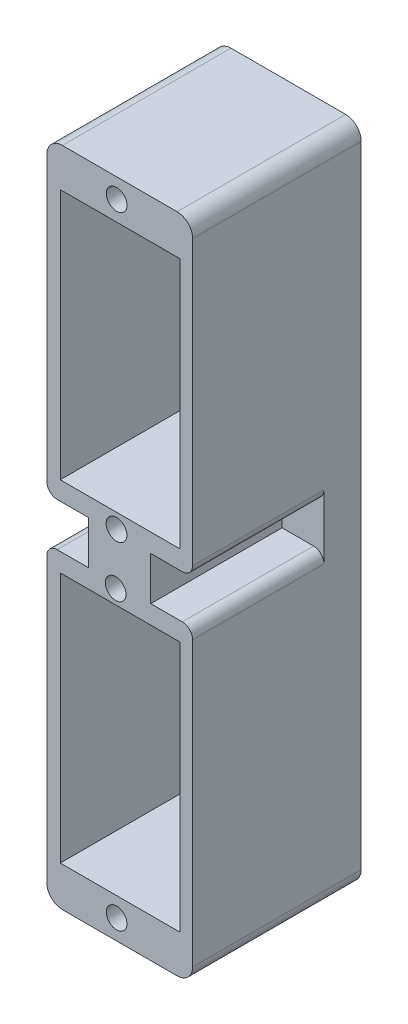
from build123d import *

# Parameters (mm, degrees)
SKETCH4_W           = 14.1
SKETCH4_H           = 64
BOSS_EXTRUDE1_DEPTH = 16.3
FILLET1_R           = 1.5
SKETCH5_W           = 11.6
SKETCH5_H           = 24.3
CUT_EXTRUDE1_DEPTH  = 16.3
SKETCH6_W           = 4.05
SKETCH6_H           = 4.2
CUT_EXTRUDE2_DEPTH  = 12.7
FILLET2_R           = 1
SKETCH7_R           = 1
CUT_EXTRUDE3_DEPTH  = 16.3


with BuildPart() as part:
    # Sketch4 → Boss-Extrude1 (new body)
    with BuildSketch(Plane.XY.offset(30)):
        with Locations((-182.786990356, 243.547210693)):
            Rectangle(SKETCH4_W, SKETCH4_H)
    extrude(amount=BOSS_EXTRUDE1_DEPTH)

    # Fillet1
    fillet1_edges = [part.edges().sort_by_distance(p)[0] for p in [
        (-189.836990356, 275.547210693, 38.15),
        (-175.736990356, 275.547210693, 38.15),
        (-189.836990356, 211.547210693, 38.15),
        (-175.736990356, 211.547210693, 38.15),
    ]]
    fillet(fillet1_edges, radius=FILLET1_R)

    # Sketch5 → Cut-Extrude1 (cut)
    with BuildSketch(Plane.XY.offset(46.3)):
        with Locations((-182.736990356, 259.597210693)):
            Rectangle(SKETCH5_W, SKETCH5_H)
        with Locations((-182.736990356, 227.497210693)):
            Rectangle(SKETCH5_W, SKETCH5_H)
    extrude(amount=-CUT_EXTRUDE1_DEPTH, mode=Mode.SUBTRACT)

    # Sketch6 → Cut-Extrude2 (cut)
    with BuildSketch(Plane.XY.offset(46.3)):
        with Locations((-187.811990356, 243.547210693)):
            Rectangle(SKETCH6_W, SKETCH6_H)
        with Locations((-177.761990356, 243.547210693)):
            Rectangle(SKETCH6_W, SKETCH6_H)
    extrude(amount=-CUT_EXTRUDE2_DEPTH, mode=Mode.SUBTRACT)

    # Fillet2
    fillet2_edges = [part.edges().sort_by_distance(p)[0] for p in [
        (-175.736990356, 241.447210693, 39.95),
        (-175.736990356, 245.647210693, 39.95),
        (-189.836990356, 241.447210693, 39.95),
        (-189.836990356, 245.647210693, 39.95),
    ]]
    fillet(fillet2_edges, radius=FILLET2_R)

    # Sketch7 → Cut-Extrude3 (cut)
    with BuildSketch(Plane.XY.offset(46.3)):
        with Locations((-183.086103711, 273.651926582)):
            Circle(SKETCH7_R)
        with Locations((-183.086103711, 213.475534384)):
            Circle(SKETCH7_R)
        with Locations((-183.098908316, 246.016003292)):
            Circle(SKETCH7_R)
        with Locations((-183.18196106, 241.016693115)):
            Circle(SKETCH7_R)
    extrude(amount=-CUT_EXTRUDE3_DEPTH, mode=Mode.SUBTRACT)


solid = part.part
